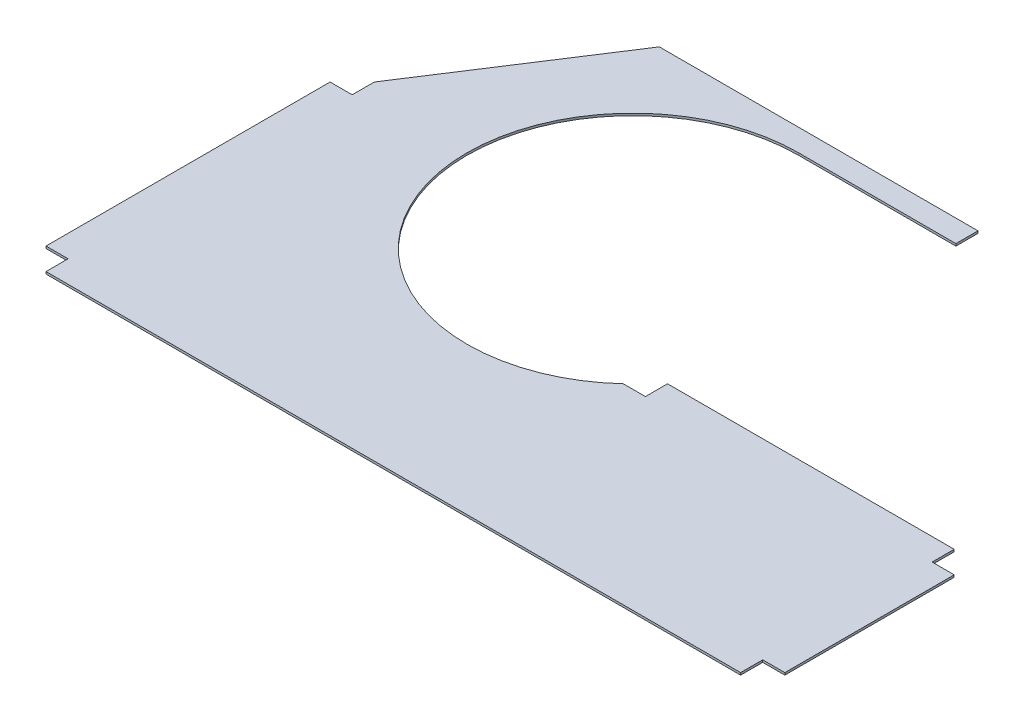
from build123d import *

# Parameters (mm, degrees)
BOSS_EXTRUDE1_DEPTH = 2


with BuildPart() as part:
    # Sketch1 → Boss-Extrude1 (new body)
    with BuildSketch(Plane(origin=(0, 0, 0), x_dir=(1, 0, 0), z_dir=(0, 1, 0))):
        with BuildLine():
            Line((0, 0), (20, 0))
            Line((20, 0), (20, -20))
            Line((20, -20), (648.38, -20))
            Line((648.38, -20), (648.38, 0))
            Line((648.38, 0), (668.38, 0))
            Line((668.38, 0), (668.38, 153.21))
            Line((668.38, 153.21), (648.38, 153.21))
            Line((648.38, 153.21), (648.38, 173.21))
            Line((648.38, 173.21), (389.050549084, 173.21))
            Line((389.050549084, 173.21), (389.050549084, 153.21))
            Line((389.050549084, 153.21), (369.050549084, 153.21))
            ThreePointArc((369.050549084, 153.21), (127.630440102, 208.858094035), (267.339788036, 413.45935867))
            Line((267.339788036, 413.45935867), (409.658335612, 413.45935867))
            Line((409.658335612, 413.45935867), (409.658335612, 433.45935867))
            Line((409.658335612, 433.45935867), (121.389532072, 433.45935867))
            Line((121.389532072, 433.45935867), (20, 277))
            Line((20, 277), (20, 257))
            Line((20, 257), (0, 257))
            Line((0, 257), (0, 0))
        make_face()
    extrude(amount=BOSS_EXTRUDE1_DEPTH)


solid = part.part
